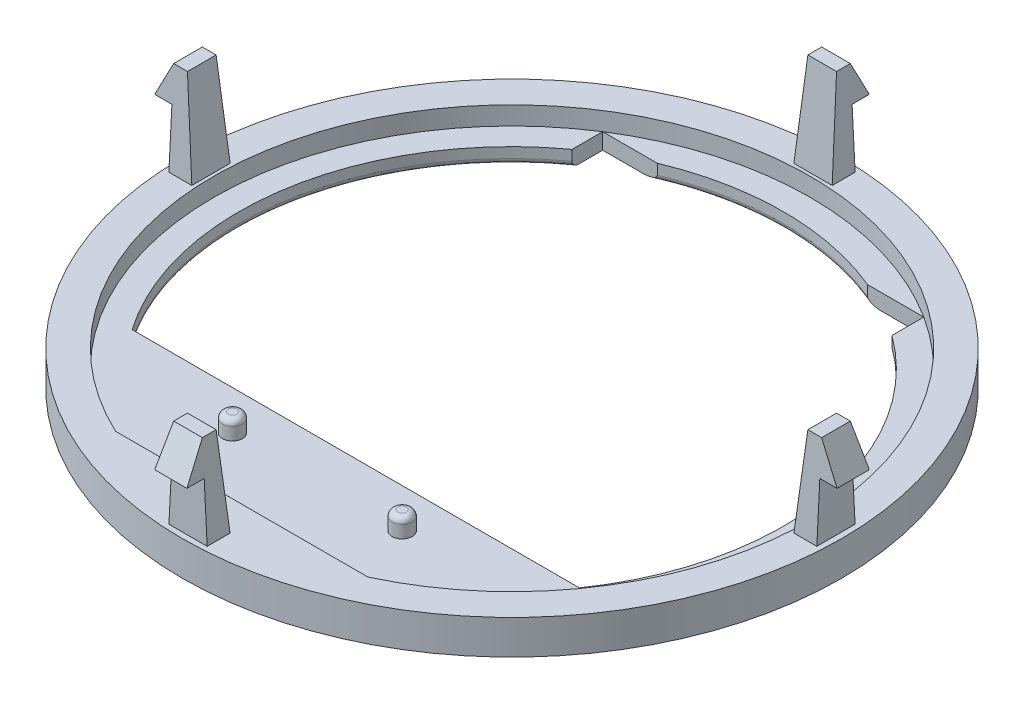
from build123d import *

# Parameters (mm, degrees)
SKETCH1_R           = 14.605
BOSS_EXTRUDE1_DEPTH = 1.524
CUT_EXTRUDE1_DEPTH  = 0.8128
SKETCH4_R           = 0.4445
BOSS_EXTRUDE2_DEPTH = 0.8128
CUT_EXTRUDE2_DEPTH  = 21.670575557
FILLET1_R           = 0.254
FILLET3_R           = 0.254
SNAP_START          = 13.7414
SNAP_HOOK1_DEPTH    = 0.6096
SNAP_START_2        = -0.714869456
SNAP_HOOK1_2_DEPTH  = 1.429738912
SNAP_START_3        = -0.847985215
SNAP_HOOK1_3_DEPTH  = 1.69597043
SNAP_START_4        = 12
SNAP_HOOK1_4_DEPTH  = 4
CIRPATTERN1_COUNT   = 4
SKETCH6_W           = 14.224
SKETCH6_H           = 9.208016637
CUT_EXTRUDE3_DEPTH  = 2.54


with BuildPart() as part:
    # Sketch1 → Boss-Extrude1 (new body)
    with BuildSketch(Plane(origin=(0, 0, 0), x_dir=(1, 0, 0), z_dir=(0, 1, 0))):
        with Locations(Location((0, 0, 0), (0, 0, 270))):
            Circle(SKETCH1_R)
    extrude(amount=BOSS_EXTRUDE1_DEPTH)

    # Sketch3 → Cut-Extrude1 (cut)
    with BuildSketch(Plane(origin=(0, 1.524, 0), x_dir=(1, 0, 0), z_dir=(0, 1, 0))):
        with BuildLine():
            Line((-5.588, -11.967686493), (5.588, -11.967686493))
            ThreePointArc((5.588, -11.967686493), (0, 13.208), (-5.588, -11.967686493))
        make_face()
    extrude(amount=-CUT_EXTRUDE1_DEPTH, mode=Mode.SUBTRACT)

    # Sketch4 → Boss-Extrude2 (add)
    with BuildSketch(Plane(origin=(0, 0.7112, 0), x_dir=(1, 0, 0), z_dir=(0, 1, 0))):
        with Locations(Location((-3.7592, -8.6233, 0), (0, 0, 90))):
            Circle(SKETCH4_R)
        with Locations(Location((3.7592, -8.6233, 0), (0, 0, 90))):
            Circle(SKETCH4_R)
    extrude(amount=BOSS_EXTRUDE2_DEPTH)

    # Sketch5 → Cut-Extrude2 (cut, through all)
    with BuildSketch(Plane(origin=(0, 0.7112, 0), x_dir=(1, 0, 0), z_dir=(0, 1, 0))):
        with BuildLine():
            Line((-9.940854815, -6.887686493), (9.870656967, -6.887686493))
            ThreePointArc((9.870656967, -6.887686493), (-0.035098924, 12.065), (-9.940854815, -6.887686493))
        make_face()
    extrude(amount=-CUT_EXTRUDE2_DEPTH, mode=Mode.SUBTRACT)

    # Fillet1
    fillet1_edges = [part.edges().sort_by_distance(p)[0] for p in [
        (-0.035098924, 0, -12.065),
        (-0.035098924, 0, 6.887686493),
    ]]
    fillet(fillet1_edges, radius=FILLET1_R)

    # Fillet3
    fillet3_edges = [part.edges().sort_by_distance(p)[0] for p in [
        (-3.7592, 1.524, 9.0678),
        (3.7592, 1.524, 9.0678),
    ]]
    fillet(fillet3_edges, radius=FILLET3_R)

    # Snap Hook1: read off the stored shape, not the designer's step
    # Snap Hook1 outline → Snap Hook1 (add)
    with BuildSketch(Plane.XY.offset(SNAP_START)):
        Polygon((-0.847985215, 1.524), (0.847985215, 1.524), (0.635, 5.588), (-0.635, 5.588), align=None)
    snap_hook1 = extrude(amount=SNAP_HOOK1_DEPTH)

    # Snap Hook1 2 outline → Snap Hook1 2 (add)
    with BuildSketch(Plane.YZ.offset(SNAP_START_2)):
        Polygon((1.524, 13.7414), (1.524, 13.335), (5.588, 13.7414), align=None)
        Polygon((4.064, 15.113), (4.064, 14.351), (5.588, 14.351), align=None)
    snap_hook1_2 = extrude(amount=SNAP_HOOK1_2_DEPTH)

    # Snap Hook1 3 outline → Snap Hook1 3 (add)
    with BuildSketch(Plane.YZ.offset(SNAP_START_3)):
        Polygon((1.524, 13.7414), (1.524, 13.335), (5.588, 13.7414), align=None)
    snap_hook1_3 = extrude(amount=SNAP_HOOK1_3_DEPTH)

    # Snap Hook1 4 outline → Snap Hook1 4 (cut)
    with BuildSketch(Plane.XY.offset(SNAP_START_4)):
        Polygon((0.847985215, 1.524), (0.847985215, 7), (0.561000216, 7), (0.635, 5.588), align=None)
        Polygon((-0.635, 5.588), (-0.561000216, 7), (-0.847985215, 7), (-0.847985215, 1.524), align=None)
    snap_hook1_4 = extrude(amount=SNAP_HOOK1_4_DEPTH, mode=Mode.SUBTRACT)

    # CirPattern1: Snap Hook1, Snap Hook1 2, Snap Hook1 3, Snap Hook1 4 ×4 about axis
    cirpattern1_axis = Axis((0, 1.524, 0), (0, 1, 0))
    add([snap_hook1.rotate(cirpattern1_axis, i * 360 / CIRPATTERN1_COUNT) for i in range(1, CIRPATTERN1_COUNT)])
    add([snap_hook1_2.rotate(cirpattern1_axis, i * 360 / CIRPATTERN1_COUNT) for i in range(1, CIRPATTERN1_COUNT)])
    add([snap_hook1_3.rotate(cirpattern1_axis, i * 360 / CIRPATTERN1_COUNT) for i in range(1, CIRPATTERN1_COUNT)])
    add([snap_hook1_4.rotate(cirpattern1_axis, i * 360 / CIRPATTERN1_COUNT) for i in range(1, CIRPATTERN1_COUNT)], mode=Mode.SUBTRACT)

    # Sketch6 → Cut-Extrude3 (cut)
    with BuildSketch(Plane(origin=(0, 0.7112, 0), x_dir=(1, 0, 0), z_dir=(0, 1, 0))):
        with Locations((0, 6.525714051)):
            Rectangle(SKETCH6_W, SKETCH6_H)
    extrude(amount=-CUT_EXTRUDE3_DEPTH, mode=Mode.SUBTRACT)


solid = part.part
